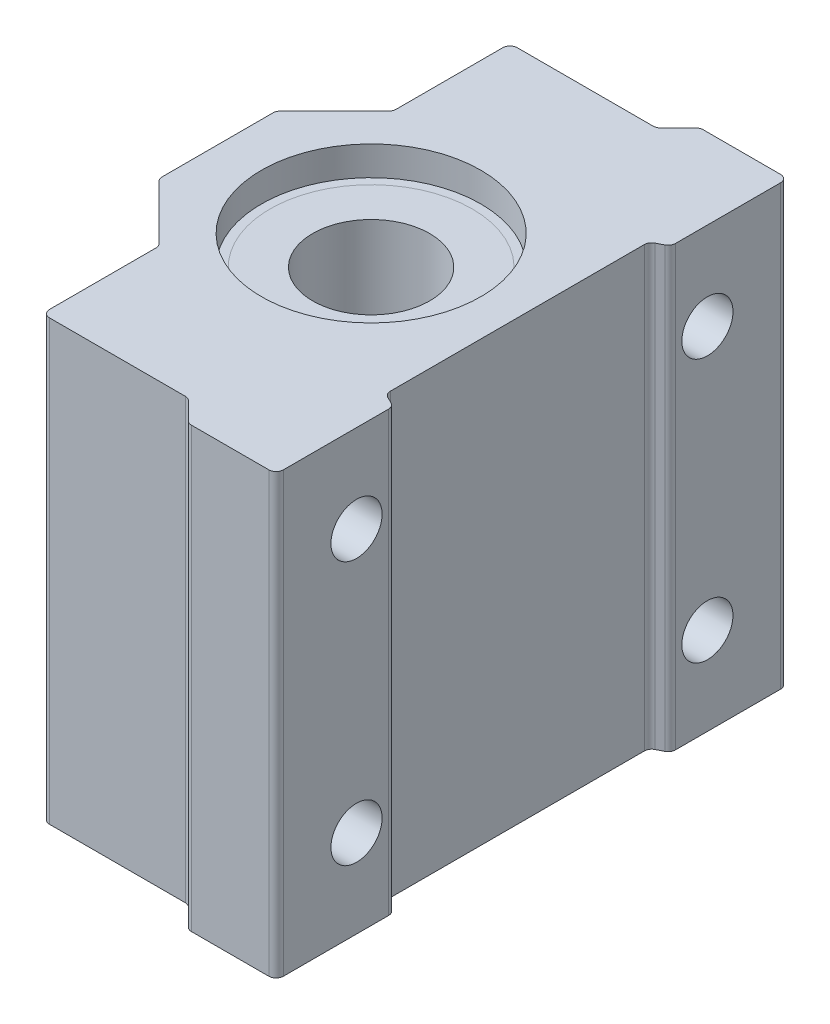
from build123d import *

# Parameters (mm, degrees)
BOSS_EXTRUDE1_DEPTH = 30
FILLET1_R           = 0.5
SKETCH2_R           = 7.5
CUT_EXTRUDE1_DEPTH  = 30
SKETCH4_R           = 7.5
SKETCH4_R_2         = 6.911436733
BOSS_EXTRUDE2_DEPTH = 26
SKETCH5_R           = 6.911436733
SKETCH5_R_2         = 4
BOSS_EXTRUDE3_DEPTH = 26
SKETCH6_R           = 1.75
CUT_EXTRUDE2_DEPTH  = 26


with BuildPart() as part:
    # Sketch1 → Boss-Extrude1 (new body)
    with BuildSketch(Plane(origin=(0, 0, 0), x_dir=(1, 0, 0), z_dir=(0, 1, 0))):
        Polygon((3.543478261, 16.195652174), (-2.456521739, 16.195652174), (-3.956521739, 14.695652174), (-13.956521739, 14.695652174), (-13.956521739, 6.695652174), (-17.956521739, 2.695652174), (-17.956521739, -5.304347826), (-13.956521739, -9.304347826), (-13.956521739, -17.304347826), (-3.956521739, -17.304347826), (-2.456521739, -18.804347826), (3.543478261, -18.804347826), (3.543478261, -10.804347826), (2.543478261, -10.304347826), (2.543478261, 7.695652174), (3.543478261, 8.195652174), align=None)
    extrude(amount=BOSS_EXTRUDE1_DEPTH)

    # Fillet1
    fillet1_edges = [part.edges().sort_by_distance(p)[0] for p in [
        (-13.956521739, 15, 17.304347826),
        (-3.956521739, 15, 17.304347826),
        (-2.456521739, 15, 18.804347826),
        (3.543478261, 15, 18.804347826),
        (3.543478261, 15, 10.804347826),
        (2.543478261, 15, 10.304347826),
        (2.543478261, 15, -7.695652174),
        (3.543478261, 15, -8.195652174),
        (3.543478261, 15, -16.195652174),
        (-2.456521739, 15, -16.195652174),
        (-3.956521739, 15, -14.695652174),
        (-13.956521739, 15, -14.695652174),
        (-13.956521739, 15, -6.695652174),
        (-17.956521739, 15, -2.695652174),
        (-17.956521739, 15, 5.304347826),
        (-13.956521739, 15, 9.304347826),
    ]]
    fillet(fillet1_edges, radius=FILLET1_R)

    # Sketch2 → Cut-Extrude1 (cut)
    with BuildSketch(Plane.XZ):
        with Locations((-7.456521739, 1.304347826)):
            Circle(SKETCH2_R)
    extrude(amount=-CUT_EXTRUDE1_DEPTH, mode=Mode.SUBTRACT)

    # Sketch4 → Boss-Extrude2 (add)
    with BuildSketch(Plane(origin=(0, 2, 0), x_dir=(1, 0, 0), z_dir=(0, 1, 0))):
        with Locations((-7.456521739, -1.304347826)):
            Circle(SKETCH4_R)
        with Locations((-7.456521739, -1.304347826)):
            Circle(SKETCH4_R_2, mode=Mode.SUBTRACT)
    extrude(amount=BOSS_EXTRUDE2_DEPTH)

    # Sketch6 → Cut-Extrude2 (cut)
    with BuildSketch(Plane.ZY.offset(13.956521739)):
        with Locations((13.304347826, 24)):
            Circle(SKETCH6_R)
        with Locations((13.304347826, 6)):
            Circle(SKETCH6_R)
        with Locations((-10.695652174, 6)):
            Circle(SKETCH6_R)
        with Locations((-10.695652174, 24)):
            Circle(SKETCH6_R)
    extrude(amount=-CUT_EXTRUDE2_DEPTH, mode=Mode.SUBTRACT)


with BuildPart() as body_2:
    # Sketch5 → Boss-Extrude3 (new body)
    with BuildSketch(Plane(origin=(0, 2, 0), x_dir=(1, 0, 0), z_dir=(0, 1, 0))):
        with Locations((-7.456521739, -1.304347826)):
            Circle(SKETCH5_R)
        with Locations((-7.456521739, -1.304347826)):
            Circle(SKETCH5_R_2, mode=Mode.SUBTRACT)
    extrude(amount=BOSS_EXTRUDE3_DEPTH)


solid = Compound([part.part, body_2.part])
